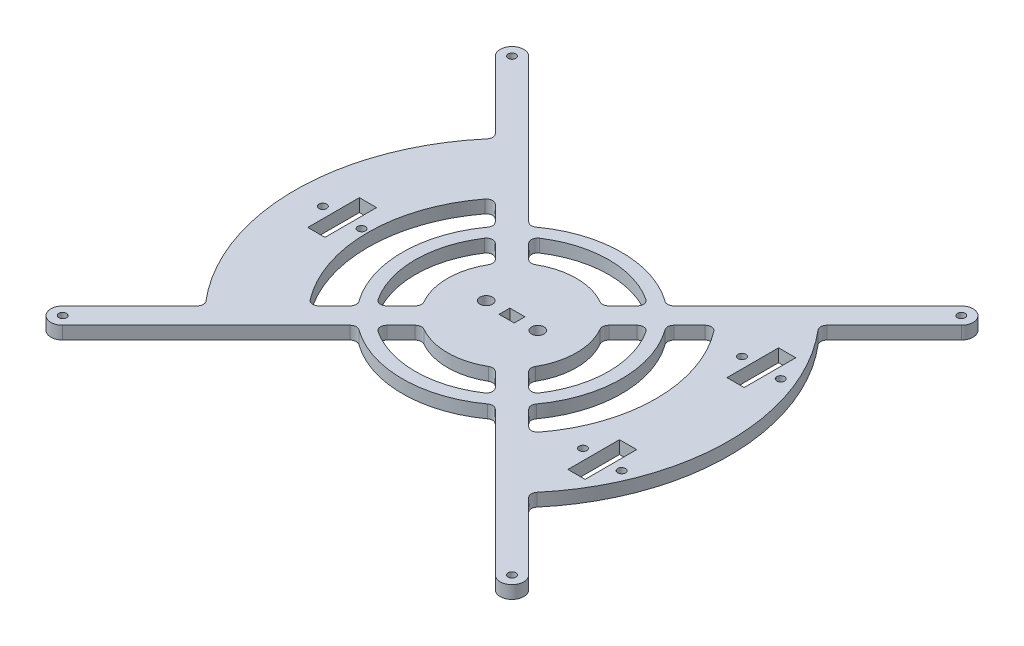
from build123d import *

# Parameters (mm, degrees)
SKETCH1_W            = 220
SKETCH1_H            = 220
SKETCH1_R            = 1.8
SKETCH1_W_2          = 8
SKETCH1_H_2          = 24
BOSS_EXTRUDE1_DEPTH  = 3
CUT_EXTRUDE1_DEPTH   = 10
FILLET1_R            = 3
M5_CLEARANCE_HOLE1_D = 5.8
SKETCH4_W            = 7
SKETCH4_H            = 5
CUT_EXTRUDE2_DEPTH   = 156.679157243


with BuildPart() as part:
    # Sketch1 → Boss-Extrude1 (new, symmetric)
    with BuildSketch(Plane(origin=(0, 0, 0), x_dir=(1, 0, 0), z_dir=(0, 1, 0))):
        Rectangle(SKETCH1_W, SKETCH1_H)
        with Locations((-104.5, 104.5)):
            Circle(SKETCH1_R, mode=Mode.SUBTRACT)
        with Locations((104.5, 104.5)):
            Circle(SKETCH1_R, mode=Mode.SUBTRACT)
        with Locations((104.5, -104.5)):
            Circle(SKETCH1_R, mode=Mode.SUBTRACT)
        with Locations((-104.5, -104.5)):
            Circle(SKETCH1_R, mode=Mode.SUBTRACT)
        with Locations((-70, 0)):
            Circle(SKETCH1_R, mode=Mode.SUBTRACT)
        with Locations((-88, 0)):
            Circle(SKETCH1_R, mode=Mode.SUBTRACT)
        with Locations((88, 37)):
            Circle(SKETCH1_R, mode=Mode.SUBTRACT)
        with Locations((70, 37)):
            Circle(SKETCH1_R, mode=Mode.SUBTRACT)
        with Locations((88, -37)):
            Circle(SKETCH1_R, mode=Mode.SUBTRACT)
        with Locations((70, -37)):
            Circle(SKETCH1_R, mode=Mode.SUBTRACT)
        with Locations((-79, 0)):
            Rectangle(SKETCH1_W_2, SKETCH1_H_2, mode=Mode.SUBTRACT)
        with Locations((79, 37)):
            Rectangle(SKETCH1_W_2, SKETCH1_H_2, mode=Mode.SUBTRACT)
        with Locations((79, -37)):
            Rectangle(SKETCH1_W_2, SKETCH1_H_2, mode=Mode.SUBTRACT)
    extrude(amount=BOSS_EXTRUDE1_DEPTH, both=True)

    # Sketch2 → Cut-Extrude1 (cut)
    with BuildSketch(Plane.XZ.offset(3)):
        with BuildLine():
            Line((-104.500000026, 110), (-110, 110))
            Line((-110, 110), (-110, 104.5))
            ThreePointArc((-110, 104.5), (-108.389087306, 108.389087287), (-104.500000026, 110))
        make_face()
        with BuildLine():
            Line((104.5, 110), (-104.500000026, 110))
            ThreePointArc((-104.500000026, 110), (-102.395241134, 109.581337434), (-100.610912703, 108.389087297))
            Line((-100.610912703, 108.389087297), (-31.963039558, 39.741214151))
            ThreePointArc((-31.963039558, 39.741214151), (0, 51), (31.963039558, 39.741214151))
            Line((31.963039558, 39.741214151), (100.610912703, 108.389087297))
            ThreePointArc((100.610912703, 108.389087297), (102.395241122, 109.581337429), (104.5, 110))
        make_face()
        with BuildLine():
            ThreePointArc((-108.389087297, 100.610912703), (-109.581337429, 102.395241122), (-110, 104.5))
            Line((-110, 104.5), (-110, -104.50000001))
            ThreePointArc((-110, -104.50000001), (-109.581337431, -102.395241127), (-108.389087297, -100.610912703))
            Line((-108.389087297, -100.610912703), (-75.200902587, -67.422727994))
            ThreePointArc((-75.200902587, -67.422727994), (-101, 0), (-75.200902587, 67.422727994))
            Line((-75.200902587, 67.422727994), (-108.389087297, 100.610912703))
        make_face()
        with BuildLine():
            Line((110, 110), (104.5, 110))
            ThreePointArc((104.5, 110), (108.389087297, 108.389087297), (110, 104.5))
            Line((110, 104.5), (110, 110))
        make_face()
        with BuildLine():
            ThreePointArc((-104.5, -110), (-108.389087293, -108.3890873), (-110, -104.50000001))
            Line((-110, -104.50000001), (-110, -110))
            Line((-110, -110), (-104.5, -110))
        make_face()
        with BuildLine():
            Line((110, -104.5), (110, 104.5))
            ThreePointArc((110, 104.5), (109.581337429, 102.395241122), (108.389087297, 100.610912703))
            Line((108.389087297, 100.610912703), (75.200902587, 67.422727994))
            ThreePointArc((75.200902587, 67.422727994), (101, 0), (75.200902587, -67.422727994))
            Line((75.200902587, -67.422727994), (108.389087297, -100.610912703))
            ThreePointArc((108.389087297, -100.610912703), (109.581337429, -102.395241122), (110, -104.5))
        make_face()
        with BuildLine():
            ThreePointArc((-100.610912703, -108.389087297), (-102.395241122, -109.581337429), (-104.5, -110))
            Line((-104.5, -110), (104.5, -110))
            ThreePointArc((104.5, -110), (102.395241122, -109.581337429), (100.610912703, -108.389087297))
            Line((100.610912703, -108.389087297), (31.963039558, -39.741214151))
            ThreePointArc((31.963039558, -39.741214151), (0, -51), (-31.963039558, -39.741214151))
            Line((-31.963039558, -39.741214151), (-100.610912703, -108.389087297))
        make_face()
        with BuildLine():
            Line((110, -110), (110, -104.5))
            ThreePointArc((110, -104.5), (108.389087297, -108.389087297), (104.5, -110))
            Line((104.5, -110), (110, -110))
        make_face()
        with BuildLine():
            Line((-39.741214151, 31.963039558), (-51.10534509, 43.327170497))
            ThreePointArc((-51.10534509, 43.327170497), (-67, 0), (-51.10534509, -43.327170497))
            Line((-51.10534509, -43.327170497), (-39.741214151, -31.963039558))
            ThreePointArc((-39.741214151, -31.963039558), (-51, 0), (-39.741214151, 31.963039558))
        make_face()
        with BuildLine():
            ThreePointArc((51.10534509, -43.327170497), (67, 0), (51.10534509, 43.327170497))
            Line((51.10534509, 43.327170497), (39.741214151, 31.963039558))
            ThreePointArc((39.741214151, 31.963039558), (51, 0), (39.741214151, -31.963039558))
            Line((39.741214151, -31.963039558), (51.10534509, -43.327170497))
        make_face()
        with BuildLine():
            ThreePointArc((27.692157137, 35.470331731), (0, 45), (-27.692157137, 35.470331731))
            Line((-27.692157137, 35.470331731), (-16.964569457, 24.74274405))
            ThreePointArc((-16.964569457, 24.74274405), (0, 30), (16.964569457, 24.74274405))
            Line((16.964569457, 24.74274405), (27.692157137, 35.470331731))
        make_face()
        with BuildLine():
            Line((-24.74274405, 16.964569457), (-35.470331731, 27.692157137))
            ThreePointArc((-35.470331731, 27.692157137), (-45, 0), (-35.470331731, -27.692157137))
            Line((-35.470331731, -27.692157137), (-24.74274405, -16.964569457))
            ThreePointArc((-24.74274405, -16.964569457), (-30, 0), (-24.74274405, 16.964569457))
        make_face()
        with BuildLine():
            ThreePointArc((35.470331731, -27.692157137), (45, 0), (35.470331731, 27.692157137))
            Line((35.470331731, 27.692157137), (24.74274405, 16.964569457))
            ThreePointArc((24.74274405, 16.964569457), (30, 0), (24.74274405, -16.964569457))
            Line((24.74274405, -16.964569457), (35.470331731, -27.692157137))
        make_face()
        with BuildLine():
            Line((-16.964569457, -24.74274405), (-27.692157137, -35.470331731))
            ThreePointArc((-27.692157137, -35.470331731), (0, -45), (27.692157137, -35.470331731))
            Line((27.692157137, -35.470331731), (16.964569457, -24.74274405))
            ThreePointArc((16.964569457, -24.74274405), (0, -30), (-16.964569457, -24.74274405))
        make_face()
    extrude(amount=-CUT_EXTRUDE1_DEPTH, mode=Mode.SUBTRACT)

    # Fillet1
    fillet1_edges = [part.edges().sort_by_distance(p)[0] for p in [
        (-75.200902587, 0, -67.422727994),
        (-75.200902587, 0, 67.422727994),
        (-51.10534509, 0, -43.327170497),
        (-51.10534509, 0, 43.327170497),
        (-39.741214151, 0, 31.963039558),
        (-31.963039558, 0, -39.741214151),
        (-39.741214151, 0, -31.963039558),
        (-24.74274405, 0, -16.964569457),
        (-24.74274405, 0, 16.964569457),
        (-35.470331731, 0, 27.692157137),
        (-35.470331731, 0, -27.692157137),
        (-27.692157137, 0, -35.470331731),
        (27.692157137, 0, -35.470331731),
        (-16.964569457, 0, -24.74274405),
        (16.964569457, 0, -24.74274405),
        (31.963039558, 0, -39.741214151),
        (75.200902587, 0, 67.422727994),
        (75.200902587, 0, -67.422727994),
        (51.10534509, 0, 43.327170497),
        (51.10534509, 0, -43.327170497),
        (39.741214151, 0, -31.963039558),
        (24.74274405, 0, -16.964569457),
        (35.470331731, 0, -27.692157137),
        (24.74274405, 0, 16.964569457),
        (16.964569457, 0, 24.74274405),
        (-16.964569457, 0, 24.74274405),
        (35.470331731, 0, 27.692157137),
        (39.741214151, 0, 31.963039558),
        (27.692157137, 0, 35.470331731),
        (31.963039558, 0, 39.741214151),
        (-27.692157137, 0, 35.470331731),
        (-31.963039558, 0, 39.741214151),
    ]]
    fillet(fillet1_edges, radius=FILLET1_R)

    # M5 Clearance Hole1 (through all)
    with Locations(Plane(origin=(-12, -3, 0), x_dir=(0, 0, -1), z_dir=(0, -1, 0))):
        with Locations((0, 0), (0, 24)):
            Hole(M5_CLEARANCE_HOLE1_D / 2)

    # Sketch4 → Cut-Extrude2 (cut, through all)
    with BuildSketch(Plane(origin=(0, 3, 0), x_dir=(1, 0, 0), z_dir=(0, 1, 0))):
        Rectangle(SKETCH4_W, SKETCH4_H)
    extrude(amount=-CUT_EXTRUDE2_DEPTH, mode=Mode.SUBTRACT)


solid = part.part
